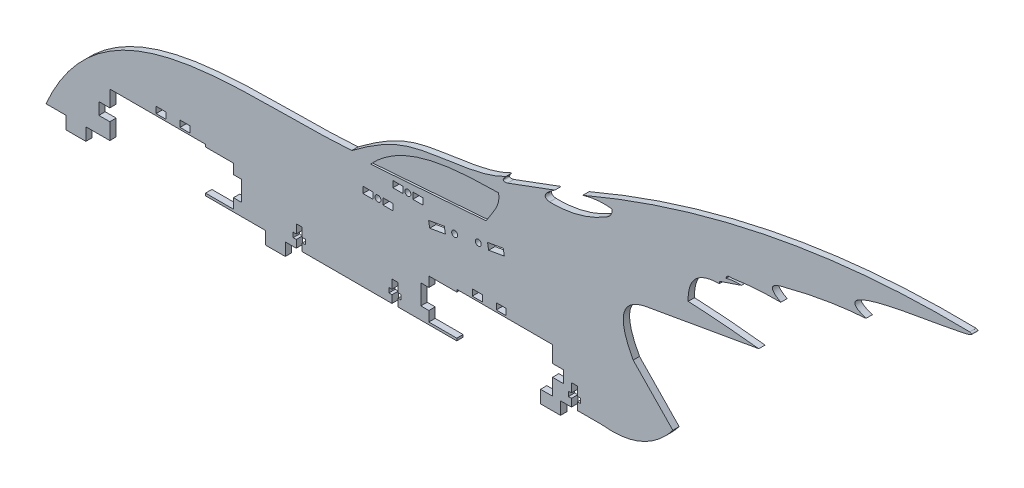
from build123d import *

# Parameters (mm, degrees)
BOSS_EXTRUDE1_DEPTH = 3.175
SKETCH3_W           = 10
SKETCH3_H           = 6.35
BOSS_EXTRUDE2_DEPTH = 3.175
CUT_EXTRUDE1_DEPTH  = 1
CUT_EXTRUDE2_DEPTH  = 309.914260869
SKETCH7_W           = 5
SKETCH7_H           = 3.175
CUT_EXTRUDE3_DEPTH  = 309.914260869
SKETCH8_R           = 1.5
CUT_EXTRUDE4_DEPTH  = 309.914260869
SKETCH9_R           = 1.5
SKETCH9_W           = 5
SKETCH9_H           = 3.175
CUT_EXTRUDE5_DEPTH  = 309.914260869


with BuildPart() as part:
    # Sketch2 → Boss-Extrude1 (new body)
    with BuildSketch(Plane.XY):
        with BuildLine():
            Line((-171.469047232, -34.076589663), (107.072734851, -34.076589663))
            add(Edge.make_bspline(
                [(107.072734851, -34.076589663), (128.968224532, -36.583015685), (142.892082906, -18.715522774)],
                knots=[0, 0, 0, 1, 1, 1], degree=2))
            Line((142.892082906, -18.715522774), (122.99960361, 1.8225486))
            add(Edge.make_bspline(
                [(129.812103759, 28.346921979), (110.367502019, 24.835662341), (122.99960361, 1.8225486)],
                knots=[0, 0, 0, 1, 1, 1], degree=2))
            Line((129.812103759, 28.346921979), (185.982982819, 38.244685161))
            add(Edge.make_bspline(
                [(150.588622768, 41.132714976), (168.332466646, 40.241827569), (185.982982819, 38.244685161)],
                knots=[0, 0, 0, 1, 1, 1], degree=2))
            add(Edge.make_bspline(
                [(166.211544782, 56.600045126), (150.111599454, 56.448151942), (150.588622768, 41.132714976)],
                knots=[0, 0, 0, 1, 1, 1], degree=2))
            Line((166.211544782, 56.600045126), (166.232711914, 57.669663084))
            Line((166.232711914, 57.669663084), (177.243348067, 61.403308501))
            add(Edge.make_bspline(
                [(177.243348067, 61.403308501), (173.339529375, 61.796609349), (169.627135034, 60.610840144)],
                knots=[0, 0, 0, 1, 1, 1], degree=2))
            add(Edge.make_bspline(
                [(169.627135034, 60.610840144), (169.762853876, 62.544945332), (172.402329475, 62.156522878)],
                knots=[0, 0, 0, 1, 1, 1], degree=2))
            add(Edge.make_bspline(
                [(172.402329475, 62.156522878), (184.617311888, 64.041519989), (197.029812567, 63.947302758)],
                knots=[0, 0, 0, 1, 1, 1], degree=2))
            add(Edge.make_bspline(
                [(197.029812567, 63.947302758), (187.73474396, 69.069639789), (198.964387884, 71.402059066)],
                knots=[0, 0, 0, 1, 1, 1], degree=2))
            add(Edge.make_bspline(
                [(198.964387884, 71.402059066), (219.003547299, 76.786528717), (239.76459105, 78.329887141)],
                knots=[0, 0, 0, 1, 1, 1], degree=2))
            add(Edge.make_bspline(
                [(291.780939868, 98.47138823), (303.090852198, 95.717715254), (210.844028254, 88.026417155), (239.76459105, 78.329887141)],
                knots=[0, 0, 0, 0, 1, 1, 1, 1], degree=3))
            add(Edge.make_bspline(
                [(291.780939868, 98.47138823), (190.608851514, 100.539390251), (97.737935683, 60.775941524)],
                knots=[0, 0, 0, 1, 1, 1], degree=2))
            add(Edge.make_bspline(
                [(97.737935683, 60.775941524), (104.92881908, 63.001143493), (112.379572637, 62.156522878)],
                knots=[0, 0, 0, 1, 1, 1], degree=2))
            add(Edge.make_bspline(
                [(112.379572637, 62.156522878), (112.730110756, 59.051830939), (109.55036868, 57.311722682)],
                knots=[0, 0, 0, 1, 1, 1], degree=2))
            add(Edge.make_bspline(
                [(109.55036868, 57.311722682), (96.530025853, 49.246897899), (81.058579137, 49.55282081)],
                knots=[0, 0, 0, 1, 1, 1], degree=2))
            add(Edge.make_bspline(
                [(81.058579137, 49.55282081), (75.642299748, 50.628036984), (83.696612356, 55.998318906)],
                knots=[0, 0, 0, 1, 1, 1], degree=2))
            Line((83.696612356, 55.998318906), (60.023408157, 47.198036308))
            add(Edge.make_bspline(
                [(60.023408157, 47.198036308), (56.150260782, 46.24516321), (59.12376331, 49.613311176)],
                knots=[0, 0, 0, 1, 1, 1], degree=2))
            add(Edge.make_bspline(
                [(59.12376331, 49.613311176), (44.292473838, 41.921501166), (13.209344651, 43.405332099), (-7.707186428, 29.993825045), (-18.106560521, 22.301338951)],
                knots=[0, 0, 0, 0, 0.606338938, 1, 1, 1, 1], degree=3))
            add(Edge.make_bspline(
                [(-18.106560521, 22.301338951), (-73.30010729, 18.178725753), (-142.381543794, 32.928841514), (-171.469047232, -34.076589663)],
                knots=[0, 0, 0, 0, 1, 1, 1, 1], degree=3))
        make_face()
    extrude(amount=BOSS_EXTRUDE1_DEPTH)

    # Sketch3 → Boss-Extrude2 (add)
    with BuildSketch(Plane.XY.offset(3.175)):
        with Locations((-156.469047232, -37.251589663)):
            Rectangle(SKETCH3_W, SKETCH3_H)
        with Locations((-56.469047232, -37.251589663)):
            Rectangle(SKETCH3_W, SKETCH3_H)
        with Locations((81.530952768, -37.251589663)):
            Rectangle(SKETCH3_W, SKETCH3_H)
    extrude(amount=-BOSS_EXTRUDE2_DEPTH)

    # Sketch4 → Cut-Extrude1 (cut)
    with BuildSketch(Plane.XY.offset(3.175)):
        with BuildLine():
            Line((-8.735344321, 21.076667257), (49.27249451, 25.443679203))
            add(Edge.make_bspline(
                [(55.435775055, 40.720887474), (56.710717132, 34.955549426), (51.7521577, 29.95185464), (49.27249451, 25.443679203)],
                knots=[0, 0, 0, 0, 1, 1, 1, 1], degree=3))
            add(Edge.make_bspline(
                [(55.435775055, 40.720887474), (33.054612951, 40.360145045), (7.874054379, 39.272954497), (-8.735344321, 21.076667257)],
                knots=[0, 0, 0, 0, 1, 1, 1, 1], degree=3))
        make_face()
    extrude(amount=-CUT_EXTRUDE1_DEPTH, mode=Mode.SUBTRACT)

    # Sketch5 → Cut-Extrude2 (cut, through all)
    with BuildSketch(Plane.XY.offset(3.175)):
        Polygon((-45.969047232, -34.076589663), (-42.969047232, -34.076589663), (-42.969047232, -30.276589663), (-41.419047232, -30.276589663), (-41.419047232, -27.876589663), (-42.969047232, -27.876589663), (-42.969047232, -23.426589663), (-45.969047232, -23.426589663), (-45.969047232, -27.876589663), (-47.519047232, -27.876589663), (-47.519047232, -30.276589663), (-45.969047232, -30.276589663), align=None)
        Polygon((2.030952768, -30.276589663), (2.030952768, -34.076589663), (5.030952768, -34.076589663), (5.030952768, -30.276589663), (6.580952768, -30.276589663), (6.580952768, -27.876589663), (5.030952768, -27.876589663), (5.030952768, -23.426589663), (2.030952768, -23.426589663), (2.030952768, -27.876589663), (0.480952768, -27.876589663), (0.480952768, -30.276589663), align=None)
        Polygon((92.030952768, -30.276589663), (92.030952768, -34.076589663), (95.030952768, -34.076589663), (95.030952768, -30.276589663), (96.580952768, -30.276589663), (96.580952768, -27.876589663), (95.030952768, -27.876589663), (95.030952768, -23.426589663), (92.030952768, -23.426589663), (92.030952768, -27.876589663), (90.480952768, -27.876589663), (90.480952768, -30.276589663), align=None)
    extrude(amount=-CUT_EXTRUDE2_DEPTH, mode=Mode.SUBTRACT)

    # Sketch7 → Cut-Extrude3 (cut, through all)
    with BuildSketch(Plane.XY.offset(3.175)):
        Polygon((-91.469047232, -32.876589663), (-77.469047232, -32.876589663), (-77.469047232, -27.876589663), (-73.469047232, -27.876589663), (-73.469047232, -17.876589663), (-77.469047232, -17.876589663), (-77.469047232, -12.876589663), (-91.469047232, -12.876589663), (-91.469047232, -11.676589663), (-139.469047232, -11.676589663), (-139.469047232, -19.876589663), (-144.969047232, -19.876589663), (-144.969047232, -25.876589663), (-139.469047232, -25.876589663), (-139.469047232, -34.076589663), (-91.469047232, -34.076589663), align=None)
        Polygon((20.530952768, -27.876589663), (20.530952768, -32.876589663), (34.530952768, -32.876589663), (34.530952768, -34.076589663), (82.530952768, -34.076589663), (82.530952768, -25.876589663), (88.030952768, -25.876589663), (88.030952768, -19.876589663), (82.530952768, -19.876589663), (82.530952768, -11.676589663), (34.530952768, -11.676589663), (34.530952768, -12.876589663), (20.530952768, -12.876589663), (20.530952768, -17.876589663), (16.530952768, -17.876589663), (16.530952768, -27.876589663), align=None)
        with Locations((-113.769047232, -9.149089663)):
            Rectangle(SKETCH7_W, SKETCH7_H)
        with Locations((-101.769047232, -9.149089663)):
            Rectangle(SKETCH7_W, SKETCH7_H)
        with Locations((44.830952768, -9.149089663)):
            Rectangle(SKETCH7_W, SKETCH7_H)
        with Locations((56.830952768, -9.149089663)):
            Rectangle(SKETCH7_W, SKETCH7_H)
    extrude(amount=-CUT_EXTRUDE3_DEPTH, mode=Mode.SUBTRACT)

    # Sketch8 → Cut-Extrude4 (cut, through all)
    with BuildSketch(Plane.XY.offset(3.175)):
        with Locations((33.483463602, 11.904038041)):
            Circle(SKETCH8_R)
        with Locations((45.301156639, 13.987816173)):
            Circle(SKETCH8_R)
        Polygon((20.956629295, 8.083229423), (28.835091319, 9.472414844), (28.283758355, 12.59917946), (20.405296331, 11.209994039), align=None)
        Polygon((57.827990946, 17.80862479), (49.949528922, 16.419439369), (50.500861886, 13.292674753), (58.37932391, 14.681860174), align=None)
    extrude(amount=-CUT_EXTRUDE4_DEPTH, mode=Mode.SUBTRACT)

    # Sketch9 → Cut-Extrude5 (cut, through all)
    with BuildSketch(Plane.XY.offset(3.175)):
        with Locations((10, 18)):
            Circle(SKETCH9_R)
        with Locations((-5, 8)):
            Circle(SKETCH9_R)
        with Locations((15, 18)):
            Rectangle(SKETCH9_W, SKETCH9_H)
        with Locations((5, 18)):
            Rectangle(SKETCH9_W, SKETCH9_H)
        with Locations((-10, 8)):
            Rectangle(SKETCH9_W, SKETCH9_H)
        with Locations((0, 8)):
            Rectangle(SKETCH9_W, SKETCH9_H)
    extrude(amount=-CUT_EXTRUDE5_DEPTH, mode=Mode.SUBTRACT)


solid = part.part
